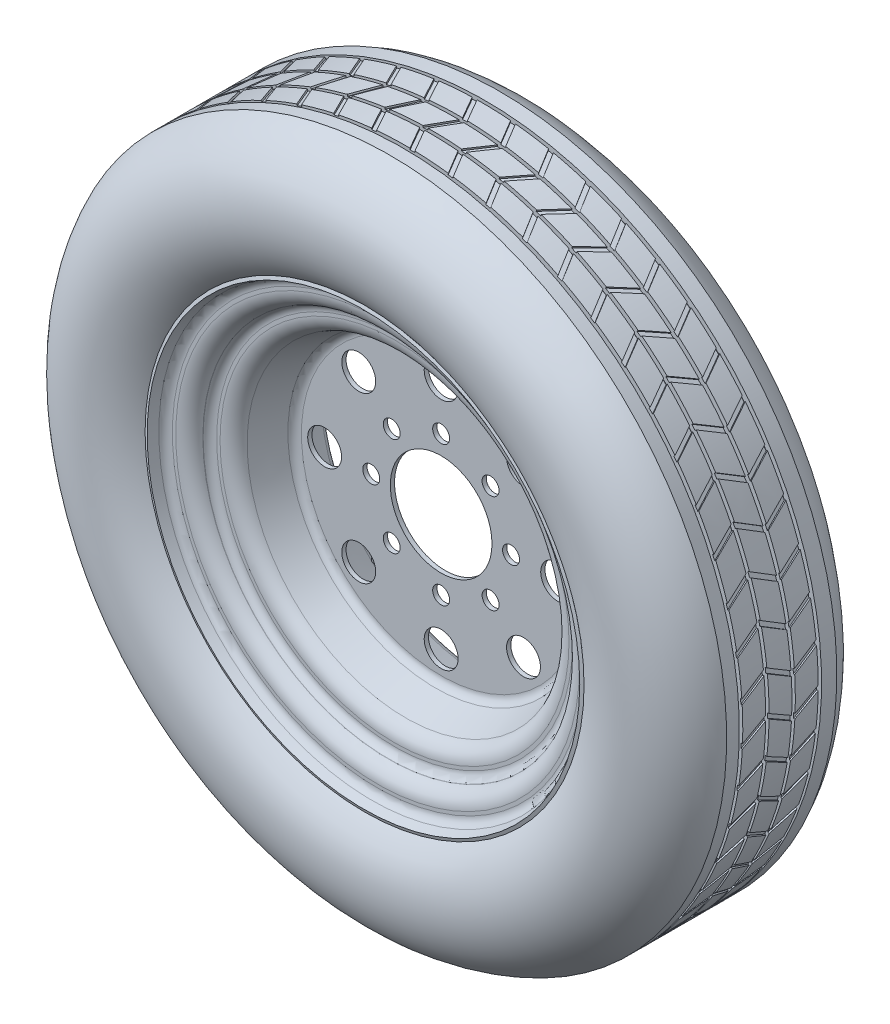
from build123d import *

# Parameters (mm, degrees)
SKETCH3_R          = 20
CUT_EXTRUDE1_DEPTH = 10
SKETCH4_R          = 10
CUT_EXTRUDE2_DEPTH = 20
SKETCH6_W          = 4
SKETCH6_H          = 7
CUT_EXTRUDE4_DEPTH = 5
CIRPATTERN1_COUNT  = 55


with BuildPart() as part:
    # Sketch1 → Revolve1 (revolve)
    with BuildSketch(Plane(origin=(0, 0, 0), x_dir=(0, 0, -1), z_dir=(1, 0, 0))):
        with BuildLine():
            Line((0, 60), (0, 164.919714672))
            ThreePointArc((0, 164.919714672), (2.712719336, 173.523361217), (9.86969785, 179.015103983))
            Line((9.86969785, 179.015103983), (45.13030215, 191.848914391))
            ThreePointArc((45.13030215, 191.848914391), (52.287280664, 197.340657157), (55, 205.944303702))
            Line((55, 205.944303702), (55, 209.938077556))
            ThreePointArc((55, 209.938077556), (57.712719336, 218.541724101), (64.86969785, 224.033466868))
            Line((64.86969785, 224.033466868), (65.13030215, 224.128319076))
            ThreePointArc((65.13030215, 224.128319076), (72.287280664, 229.620061843), (75, 238.223708388))
            Line((75, 238.223708388), (75, 242.217482242))
            ThreePointArc((75, 242.217482242), (77.712719336, 250.821128787), (84.86969785, 256.312871553))
            Line((84.86969785, 256.312871553), (95, 260))
            Line((95, 260), (93.289899283, 264.698463104))
            Line((93.289899283, 264.698463104), (83.159597133, 261.011334657))
            ThreePointArc((83.159597133, 261.011334657), (73.616959114, 253.689010969), (70, 242.217482242))
            Line((70, 242.217482242), (70, 238.223708388))
            ThreePointArc((70, 238.223708388), (68.191520443, 232.487944024), (63.420201433, 228.82678218))
            Line((63.420201433, 228.82678218), (63.159597133, 228.731929972))
            ThreePointArc((63.159597133, 228.731929972), (53.616959114, 221.409606283), (50, 209.938077556))
            Line((50, 209.938077556), (50, 205.944303702))
            ThreePointArc((50, 205.944303702), (48.191520443, 200.208539339), (43.420201433, 196.547377495))
            Line((43.420201433, 196.547377495), (8.159597133, 183.713567087))
            ThreePointArc((8.159597133, 183.713567087), (1.667311862, 179.827411576), (-2.916666667, 173.807518425))
            ThreePointArc((-2.916666667, 173.807518425), (-6.007945258, 176.925669508), (-9.86969785, 179.015103983))
            Line((-9.86969785, 179.015103983), (-45.13030215, 191.848914391))
            ThreePointArc((-45.13030215, 191.848914391), (-52.287280664, 197.340657157), (-55, 205.944303702))
            Line((-55, 205.944303702), (-55, 209.938077556))
            ThreePointArc((-55, 209.938077556), (-57.712719336, 218.541724101), (-64.86969785, 224.033466868))
            Line((-64.86969785, 224.033466868), (-65.13030215, 224.128319076))
            ThreePointArc((-65.13030215, 224.128319076), (-72.287280664, 229.620061843), (-75, 238.223708388))
            Line((-75, 238.223708388), (-75, 242.217482242))
            ThreePointArc((-75, 242.217482242), (-77.712719336, 250.821128787), (-84.86969785, 256.312871553))
            Line((-84.86969785, 256.312871553), (-95, 260))
            Line((-95, 260), (-96.710100717, 255.301536896))
            Line((-96.710100717, 255.301536896), (-86.579798567, 251.614408449))
            ThreePointArc((-86.579798567, 251.614408449), (-81.808479557, 247.953246605), (-80, 242.217482242))
            Line((-80, 242.217482242), (-80, 238.223708388))
            ThreePointArc((-80, 238.223708388), (-76.383040886, 226.752179661), (-66.840402867, 219.429855972))
            Line((-66.840402867, 219.429855972), (-66.579798567, 219.335003764))
            ThreePointArc((-66.579798567, 219.335003764), (-61.808479557, 215.67384192), (-60, 209.938077556))
            Line((-60, 209.938077556), (-60, 205.944303702))
            ThreePointArc((-60, 205.944303702), (-56.383040886, 194.472774975), (-46.840402867, 187.150451287))
            Line((-46.840402867, 187.150451287), (-11.579798567, 174.316640879))
            ThreePointArc((-11.579798567, 174.316640879), (-6.808479557, 170.655479035), (-5, 164.919714672))
            Line((-5, 164.919714672), (-5, 60))
            Line((-5, 60), (0, 60))
        make_face()
    revolve(axis=Axis((0, 0, 156.946503792), (0, 0, -1)))

    # Sketch3 → Cut-Extrude1 (cut, symmetric)
    with BuildSketch(Plane(origin=(0, 0, 0), x_dir=(-1, 0, 0), z_dir=(0, 0, -1))):
        with Locations((0, 137.5)):
            Circle(SKETCH3_R)
        with Locations((97.227182413, 97.227182413)):
            Circle(SKETCH3_R)
        with Locations((137.5, 0)):
            Circle(SKETCH3_R)
        with Locations((97.227182413, -97.227182413)):
            Circle(SKETCH3_R)
        with Locations((0, -137.5)):
            Circle(SKETCH3_R)
        with Locations((-97.227182413, -97.227182413)):
            Circle(SKETCH3_R)
        with Locations((-137.5, 0)):
            Circle(SKETCH3_R)
        with Locations((-97.227182413, 97.227182413)):
            Circle(SKETCH3_R)
    extrude(amount=CUT_EXTRUDE1_DEPTH, both=True, mode=Mode.SUBTRACT)

    # Sketch4 → Cut-Extrude2 (cut)
    with BuildSketch(Plane.XY.offset(5)):
        with Locations((0, 82.5)):
            Circle(SKETCH4_R)
        with Locations((58.336309448, 58.336309448)):
            Circle(SKETCH4_R)
        with Locations((82.5, 0)):
            Circle(SKETCH4_R)
        with Locations((58.336309448, -58.336309448)):
            Circle(SKETCH4_R)
        with Locations((0, -82.5)):
            Circle(SKETCH4_R)
        with Locations((-58.336309448, -58.336309448)):
            Circle(SKETCH4_R)
        with Locations((-82.5, 0)):
            Circle(SKETCH4_R)
        with Locations((-58.336309448, 58.336309448)):
            Circle(SKETCH4_R)
    extrude(amount=-CUT_EXTRUDE2_DEPTH, mode=Mode.SUBTRACT)


with BuildPart() as body_2:
    # Sketch5 → Revolve2 (revolve)
    with BuildSketch(Plane(origin=(0, 0, 0), x_dir=(0, 0, -1), z_dir=(1, 0, 0))):
        with BuildLine():
            Line((-65, 397), (65, 397))
            ThreePointArc((65, 397), (114.045308585, 335.401918288), (93.289899283, 259.448123454))
            Line((93.289899283, 259.448123454), (83.159597133, 261.011334657))
            Line((83.159597133, 261.011334657), (84.989661902, 272.87096631))
            Line((84.989661902, 272.87096631), (88.424138008, 272.340990852))
            ThreePointArc((88.424138008, 272.340990852), (101.88823669, 334.826727096), (62.285309105, 385))
            Line((62.285309105, 385), (-62.432120879, 385))
            ThreePointArc((-62.432120879, 385), (-103.771576243, 333.610495178), (-88.538984019, 269.440409392))
            Line((-88.538984019, 269.440409392), (-82.565932009, 268.131222339))
            Line((-82.565932009, 268.131222339), (-85.135129819, 256.409480889))
            Line((-85.135129819, 256.409480889), (-95, 258.571685454))
            ThreePointArc((-95, 258.571685454), (-115.641435349, 335.510007136), (-65, 397))
        make_face()
    revolve(axis=Axis((0, 0, -126.933617084), (0, 0, 1)))

    # Sketch6 → Cut-Revolve1 (revolve, cut)
    with BuildSketch(Plane(origin=(0, 0, 0), x_dir=(0, 0, -1), z_dir=(1, 0, 0))):
        with Locations((-48, 393.5)):
            Rectangle(SKETCH6_W, SKETCH6_H)
        with Locations((-17, 393.5)):
            Rectangle(SKETCH6_W, SKETCH6_H)
        with Locations((14, 393.5)):
            Rectangle(SKETCH6_W, SKETCH6_H)
        with Locations((45, 393.5)):
            Rectangle(SKETCH6_W, SKETCH6_H)
    revolve(axis=Axis((0, 0, -126.933617084), (0, 0, 1)), mode=Mode.SUBTRACT)

    # Sketch7 → Cut-Extrude4 (cut)
    with BuildSketch(Plane(origin=(400, 0, 0), x_dir=(0, 0, -1), z_dir=(1, 0, 0))):
        Polygon((43, 0), (16, -15.588457268), (16, -21.36195996), (43, -5.773502692), align=None)
        Polygon((12, -15.588457268), (-15, 0), (-15, -5.773502692), (12, -21.36195996), align=None)
        Polygon((-46, -15.588457268), (-46, -21.36195996), (-19, -5.773502692), (-19, 0), align=None)
    cut_extrude4 = extrude(amount=-CUT_EXTRUDE4_DEPTH, mode=Mode.SUBTRACT)

    # CirPattern1: Cut-Extrude4 ×55 about axis
    cirpattern1_axis = Axis((0, 0, -126.933617084), (0, 0, 1))
    for i in range(1, CIRPATTERN1_COUNT):
        add(cut_extrude4.rotate(cirpattern1_axis, i * 360 / CIRPATTERN1_COUNT), mode=Mode.SUBTRACT)


solid = Compound([part.part, body_2.part])
